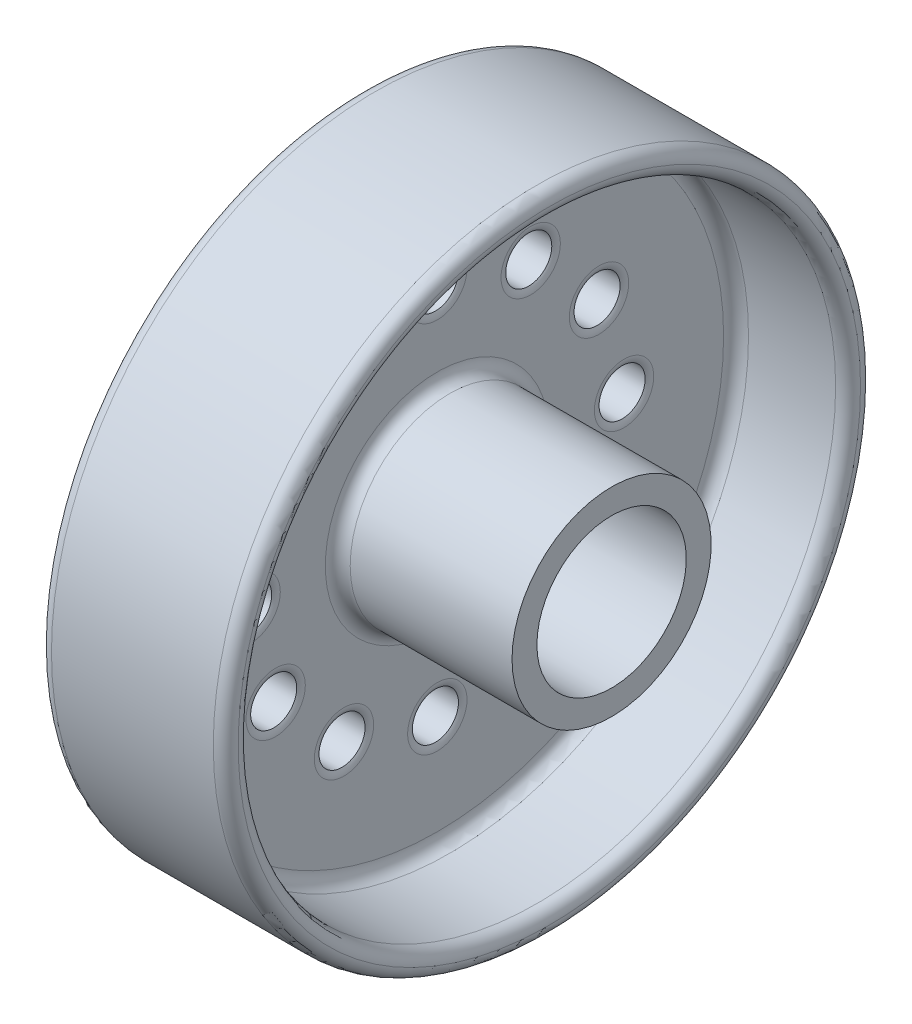
from build123d import *

# Parameters (mm, degrees)
M20X1_5_TAPPED_HOLE1_D           = 18.5
M20X1_5_TAPPED_HOLE1_CSINK_D     = 20.05
M20X1_5_TAPPED_HOLE1_CSINK_ANGLE = 90
CIRPATTERN1_COUNT                = 12
FILLET1_R                        = 5


with BuildPart() as part:
    # Sketch3 → Revolve1 (revolve)
    with BuildSketch(Plane.XY, mode=Mode.PRIVATE) as revolve1_sk:
        Polygon((100, 30), (0, 30), (0, 130), (75, 130), (75, 120), (30, 120), (30, 40), (100, 40), align=None)
    revolve(revolve1_sk.sketch.rotate(Axis((0, 0, 0), (1, 0, 0)), 90), axis=Axis((0, 0, 0), (1, 0, 0)))

    # M20x1.5 Tapped Hole1 (through all)
    with Locations(Plane(origin=(30, 0, 0), x_dir=(0, 0, -1), z_dir=(1, 0, 0))):
        with Locations((0, 75)):
            m20x1_5_tapped_hole1 = CounterSinkHole(M20X1_5_TAPPED_HOLE1_D / 2, M20X1_5_TAPPED_HOLE1_CSINK_D / 2, counter_sink_angle=M20X1_5_TAPPED_HOLE1_CSINK_ANGLE)

    # CirPattern1: M20x1.5 Tapped Hole1 ×12 about axis
    cirpattern1_axis = Axis((0, 0, 0), (1, 0, 0))
    for i in range(1, CIRPATTERN1_COUNT):
        add(m20x1_5_tapped_hole1.rotate(cirpattern1_axis, i * 360 / CIRPATTERN1_COUNT), mode=Mode.SUBTRACT)

    # Fillet1
    # the kernel refuses this fillet: 5 mm, written as the material it adds along each edge
    with BuildSketch(Plane(origin=(30, 0, 0), x_dir=(0, 0, 1), z_dir=(0, 1, 0))) as fillet1_piece_1:
        with BuildLine():
            CenterArc((120 - FILLET1_R, FILLET1_R), FILLET1_R, 270, 90)
            Line((120, FILLET1_R), (120, 0))
            Line((120, 0), (120 - FILLET1_R, 0))
        make_face()
    revolve(axis=Axis((30, 0, 0), (1, 0, 0)))
    with BuildSketch(Plane(origin=(30, 0, 0), x_dir=(0, 0, 1), z_dir=(0, 1, 0))) as fillet1_piece_2:
        with BuildLine():
            CenterArc((40 + FILLET1_R, FILLET1_R), FILLET1_R, 180, 90)
            Line((40, FILLET1_R), (40, 0))
            Line((40, 0), (40 + FILLET1_R, 0))
        make_face()
    revolve(axis=Axis((30, 0, 0), (1, 0, 0)))
    # the kernel refuses this fillet: 5 mm, written as the material it takes off along each edge
    with BuildSketch(Plane(origin=(30, 64.951905284, 37.5), x_dir=(0, -0.5000000000000002, 0.8660254037844385), z_dir=(0, -0.8660254037844385, -0.5000000000000002))) as fillet1_2_piece_1:
        with BuildLine():
            CenterArc((11.92383152, 5), FILLET1_R, 237.671935878, 32.328064122)
            Line((11.92383152, 0), (10.025, 0))
            Line((10.025, 0), (9.25, 0.775))
        make_face()
    revolve(axis=Axis((30, 64.951905284, 37.5), (-1, 0, 0)), mode=Mode.SUBTRACT)
    with BuildSketch(Plane(origin=(30, 75, 0), x_dir=(0, 0, 1), z_dir=(0, -1, 0))) as fillet1_2_piece_2:
        with BuildLine():
            CenterArc((11.92383152, 5), FILLET1_R, 237.671935878, 32.328064122)
            Line((11.92383152, 0), (10.025, 0))
            Line((10.025, 0), (9.25, 0.775))
        make_face()
    revolve(axis=Axis((30, 75, 0), (-1, 0, 0)), mode=Mode.SUBTRACT)
    with BuildSketch(Plane(origin=(30, 64.951905284, -37.5), x_dir=(0, 0.5000000000000003, 0.8660254037844385), z_dir=(0, -0.8660254037844385, 0.5000000000000003))) as fillet1_2_piece_3:
        with BuildLine():
            CenterArc((11.92383152, 5), FILLET1_R, 237.671935878, 32.328064122)
            Line((11.92383152, 0), (10.025, 0))
            Line((10.025, 0), (9.25, 0.775))
        make_face()
    revolve(axis=Axis((30, 64.951905284, -37.5), (-1, 0, 0)), mode=Mode.SUBTRACT)
    with BuildSketch(Plane(origin=(30, 37.5, -64.951905284), x_dir=(0, 0.8660254037844385, 0.5000000000000002), z_dir=(0, -0.5000000000000002, 0.8660254037844385))) as fillet1_2_piece_4:
        with BuildLine():
            CenterArc((11.92383152, 5), FILLET1_R, 237.671935878, 32.328064122)
            Line((11.92383152, 0), (10.025, 0))
            Line((10.025, 0), (9.25, 0.775))
        make_face()
    revolve(axis=Axis((30, 37.5, -64.951905284), (-1, 0, 0)), mode=Mode.SUBTRACT)
    with BuildSketch(Plane(origin=(30, 0, -75), x_dir=(0, 1, 0), z_dir=(0, 0, 1))) as fillet1_2_piece_5:
        with BuildLine():
            CenterArc((11.92383152, 5), FILLET1_R, 237.671935878, 32.328064122)
            Line((11.92383152, 0), (10.025, 0))
            Line((10.025, 0), (9.25, 0.775))
        make_face()
    revolve(axis=Axis((30, 0, -75), (-1, 0, 0)), mode=Mode.SUBTRACT)
    with BuildSketch(Plane(origin=(30, -37.5, -64.951905284), x_dir=(0, 0.8660254037844385, -0.5000000000000003), z_dir=(0, 0.5000000000000003, 0.8660254037844385))) as fillet1_2_piece_6:
        with BuildLine():
            CenterArc((11.92383152, 5), FILLET1_R, 237.671935878, 32.328064122)
            Line((11.92383152, 0), (10.025, 0))
            Line((10.025, 0), (9.25, 0.775))
        make_face()
    revolve(axis=Axis((30, -37.5, -64.951905284), (-1, 0, 0)), mode=Mode.SUBTRACT)
    with BuildSketch(Plane(origin=(30, -64.951905284, -37.5), x_dir=(0, 0.5000000000000002, -0.8660254037844385), z_dir=(0, 0.8660254037844385, 0.5000000000000002))) as fillet1_2_piece_7:
        with BuildLine():
            CenterArc((11.92383152, 5), FILLET1_R, 237.671935878, 32.328064122)
            Line((11.92383152, 0), (10.025, 0))
            Line((10.025, 0), (9.25, 0.775))
        make_face()
    revolve(axis=Axis((30, -64.951905284, -37.5), (-1, 0, 0)), mode=Mode.SUBTRACT)
    with BuildSketch(Plane(origin=(30, -75, 0), x_dir=(0, 0, -1), z_dir=(0, 1, 0))) as fillet1_2_piece_8:
        with BuildLine():
            CenterArc((11.92383152, 5), FILLET1_R, 237.671935878, 32.328064122)
            Line((11.92383152, 0), (10.025, 0))
            Line((10.025, 0), (9.25, 0.775))
        make_face()
    revolve(axis=Axis((30, -75, 0), (-1, 0, 0)), mode=Mode.SUBTRACT)
    with BuildSketch(Plane(origin=(30, -64.951905284, 37.5), x_dir=(0, -0.5000000000000002, -0.8660254037844385), z_dir=(0, 0.8660254037844385, -0.5000000000000002))) as fillet1_2_piece_9:
        with BuildLine():
            CenterArc((11.92383152, 5), FILLET1_R, 237.671935878, 32.328064122)
            Line((11.92383152, 0), (10.025, 0))
            Line((10.025, 0), (9.25, 0.775))
        make_face()
    revolve(axis=Axis((30, -64.951905284, 37.5), (-1, 0, 0)), mode=Mode.SUBTRACT)
    with BuildSketch(Plane(origin=(0, 0, 0), x_dir=(0, 0, 1), z_dir=(0, 1, 0))) as fillet1_2_piece_10:
        with BuildLine():
            CenterArc((130 - FILLET1_R, FILLET1_R), FILLET1_R, 270, 90)
            Line((130, FILLET1_R), (130, 0))
            Line((130, 0), (130 - FILLET1_R, 0))
        make_face()
    revolve(axis=Axis((0, 0, 0), (1, 0, 0)), mode=Mode.SUBTRACT)
    with BuildSketch(Plane(origin=(30, -37.5, 64.951905284), x_dir=(0, -0.8660254037844388, -0.49999999999999967), z_dir=(0, 0.49999999999999967, -0.8660254037844388))) as fillet1_2_piece_11:
        with BuildLine():
            CenterArc((11.92383152, 5), FILLET1_R, 237.671935878, 32.328064122)
            Line((11.92383152, 0), (10.025, 0))
            Line((10.025, 0), (9.25, 0.775))
        make_face()
    revolve(axis=Axis((30, -37.5, 64.951905284), (-1, 0, 0)), mode=Mode.SUBTRACT)
    with BuildSketch(Plane(origin=(75, 0, 0), x_dir=(0, 0, 1), z_dir=(0, 1, 0))) as fillet1_2_piece_12:
        with BuildLine():
            CenterArc((130 - FILLET1_R, -FILLET1_R), FILLET1_R, 0, 90)
            Line((130 - FILLET1_R, 0), (130, 0))
            Line((130, 0), (130, -FILLET1_R))
        make_face()
    revolve(axis=Axis((75, 0, 0), (1, 0, 0)), mode=Mode.SUBTRACT)
    with BuildSketch(Plane(origin=(30, 0, 75), x_dir=(0, -1, 0), z_dir=(0, 0, -1))) as fillet1_2_piece_13:
        with BuildLine():
            CenterArc((11.92383152, 5), FILLET1_R, 237.671935878, 32.328064122)
            Line((11.92383152, 0), (10.025, 0))
            Line((10.025, 0), (9.25, 0.775))
        make_face()
    revolve(axis=Axis((30, 0, 75), (-1, 0, 0)), mode=Mode.SUBTRACT)
    with BuildSketch(Plane(origin=(75, 0, 0), x_dir=(0, 0, 1), z_dir=(0, 1, 0))) as fillet1_2_piece_14:
        with BuildLine():
            CenterArc((120 + FILLET1_R, -FILLET1_R), FILLET1_R, 90, 90)
            Line((120, -FILLET1_R), (120, 0))
            Line((120, 0), (120 + FILLET1_R, 0))
        make_face()
    revolve(axis=Axis((75, 0, 0), (1, 0, 0)), mode=Mode.SUBTRACT)
    with BuildSketch(Plane(origin=(30, 37.5, 64.951905284), x_dir=(0, -0.8660254037844385, 0.5000000000000002), z_dir=(0, -0.5000000000000002, -0.8660254037844385))) as fillet1_2_piece_15:
        with BuildLine():
            CenterArc((11.92383152, 5), FILLET1_R, 237.671935878, 32.328064122)
            Line((11.92383152, 0), (10.025, 0))
            Line((10.025, 0), (9.25, 0.775))
        make_face()
    revolve(axis=Axis((30, 37.5, 64.951905284), (-1, 0, 0)), mode=Mode.SUBTRACT)


solid = part.part
